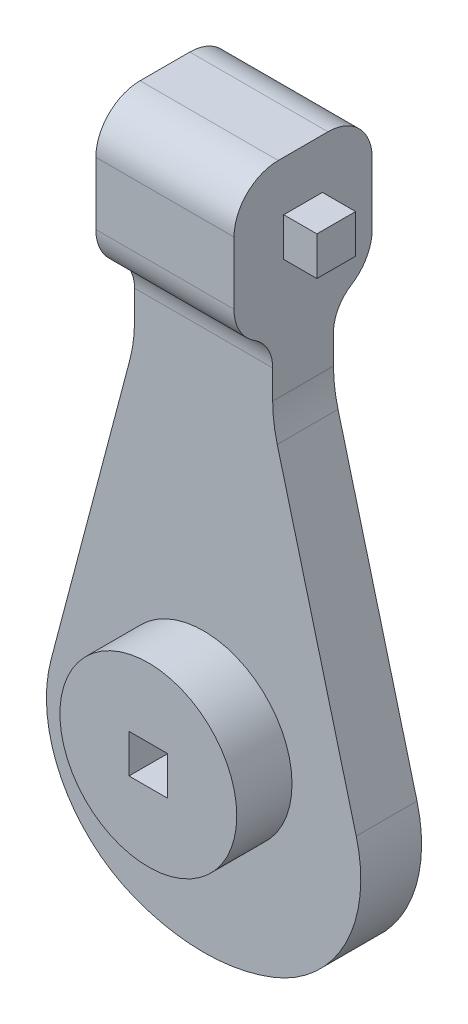
from build123d import *

# Parameters (mm, degrees)
SKETCH1_R                = 20
SKETCH1_R_2              = 4
BOSS_EXTRUDE1_DEPTH      = 11
SKETCH1_4_R              = 20
BOSS_EXTRUDE2_DEPTH      = 6
SKETCH3_R                = 16
BOSS_EXTRUDE3_DEPTH      = 10
SKETCH4_W                = 7
SKETCH4_H                = 7
CUT_EXTRUDE1_DEPTH       = 7
BOSS_EXTRUDE4_DEPTH      = 7
BOSS_EXTRUDE4_DEPTH_BACK = 18
SKETCH5_W                = 25
SKETCH5_H                = 25
SKETCH6_W                = 7
SKETCH6_H                = 7
BOSS_EXTRUDE5_DEPTH      = 6
CUT_EXTRUDE2_DEPTH       = 11
FILLET1_R                = 7
FILLET2_R                = 7
FILLET3_R                = 8


with BuildPart() as part:
    # Sketch1 → Boss-Extrude1 (new body)
    with BuildSketch(Plane.XY):
        with BuildLine():
            Line((-27.617597302, -2.366025969), (-13.325344527, 51.86810446))
            ThreePointArc((-13.325344527, 51.86810446), (-12.707194725, 55.026842667), (-12.5, 58.238821277))
            Line((-12.5, 58.238821277), (-12.5, 67.307346))
            Line((-12.5, 67.307346), (-12.5, 95.903667694))
            ThreePointArc((-12.5, 95.903667694), (0, 100.951833847), (12.5, 95.903667694))
            Line((12.5, 95.903667694), (12.5, 67.307346))
            Line((12.5, 67.307346), (12.5, 58.238821277))
            ThreePointArc((12.5, 58.238821277), (12.707194725, 55.026842667), (13.325344527, 51.86810446))
            Line((13.325344527, 51.86810446), (27.617597302, -2.366025969))
            ThreePointArc((27.617597302, -2.366025969), (25.744947954, -20.033668156), (12.608807935, -31.995867846))
            ThreePointArc((12.608807935, -31.995867846), (0, -34.390661476), (-12.608807935, -31.995867846))
            ThreePointArc((-12.608807935, -31.995867846), (-25.744947954, -20.033668156), (-27.617597302, -2.366025969))
        make_face()
        Circle(SKETCH1_R, mode=Mode.SUBTRACT)
        with Locations((0, 82.951833847)):
            Circle(SKETCH1_R_2, mode=Mode.SUBTRACT)
    extrude(amount=-BOSS_EXTRUDE1_DEPTH)

    # Sketch1<4> → Boss-Extrude2 (add)
    with BuildSketch(Plane.XY):
        Circle(SKETCH1_4_R)
    extrude(amount=-BOSS_EXTRUDE2_DEPTH)

    # Sketch3 → Boss-Extrude3 (add)
    with BuildSketch(Plane.XY):
        Circle(SKETCH3_R)
    extrude(amount=BOSS_EXTRUDE3_DEPTH)

    # Sketch4 → Cut-Extrude1 (cut)
    with BuildSketch(Plane.XY.offset(10)):
        Rectangle(SKETCH4_W, SKETCH4_H)
    extrude(amount=-CUT_EXTRUDE1_DEPTH, mode=Mode.SUBTRACT)

    # Sketch5 → Boss-Extrude4 (add, two sides: drawn at the far end of the back side and taken through both)
    with BuildSketch(Plane.XY.offset(-BOSS_EXTRUDE4_DEPTH_BACK)):
        with Locations((0, 82.951833847)):
            Rectangle(SKETCH5_W, SKETCH5_H)
    extrude(amount=BOSS_EXTRUDE4_DEPTH + BOSS_EXTRUDE4_DEPTH_BACK)

    # Sketch6 → Boss-Extrude5 (add)
    with BuildSketch(Plane(origin=(12.5, 0, 0), x_dir=(0, 0, -1), z_dir=(1, 0, 0))):
        with Locations((5.5, 82.951833847)):
            Rectangle(SKETCH6_W, SKETCH6_H)
    boss_extrude5 = extrude(amount=BOSS_EXTRUDE5_DEPTH)

    # Mirror1: Boss-Extrude5 across plane
    add(boss_extrude5.mirror(Plane(origin=(0, 0, 0), x_dir=(0, 0, 1), z_dir=(1, 0, 0))))

    # Sketch7 → Cut-Extrude2 (cut)
    with BuildSketch(Plane.XY):
        with BuildLine():
            Line((-12.5, 95.451833847), (12.5, 95.451833847))
            Line((12.5, 95.451833847), (12.5, 95.903667694))
            ThreePointArc((12.5, 95.903667694), (0, 100.951833847), (-12.5, 95.903667694))
            Line((-12.5, 95.903667694), (-12.5, 95.451833847))
        make_face()
    extrude(amount=-CUT_EXTRUDE2_DEPTH, mode=Mode.SUBTRACT)

    # Fillet1
    fillet1_edges = [part.edges().sort_by_distance(p)[0] for p in [
        (0, 70.451833847, 0),
    ]]
    fillet(fillet1_edges, radius=FILLET1_R - 0.0001)  # a hair under: the kernel refuses the full size

    # Fillet2
    fillet2_edges = [part.edges().sort_by_distance(p)[0] for p in [
        (0, 70.451833847, -11),
    ]]
    fillet(fillet2_edges, radius=FILLET2_R - 0.0001)  # a hair under: the kernel refuses the full size

    # Fillet3
    fillet3_edges = [part.edges().sort_by_distance(p)[0] for p in [
        (0, 70.451833847, -18),
        (0, 95.451833847, -18),
        (0, 95.451833847, 7),
        (0, 70.451833847, 7),
    ]]
    fillet(fillet3_edges, radius=FILLET3_R)


solid = part.part
